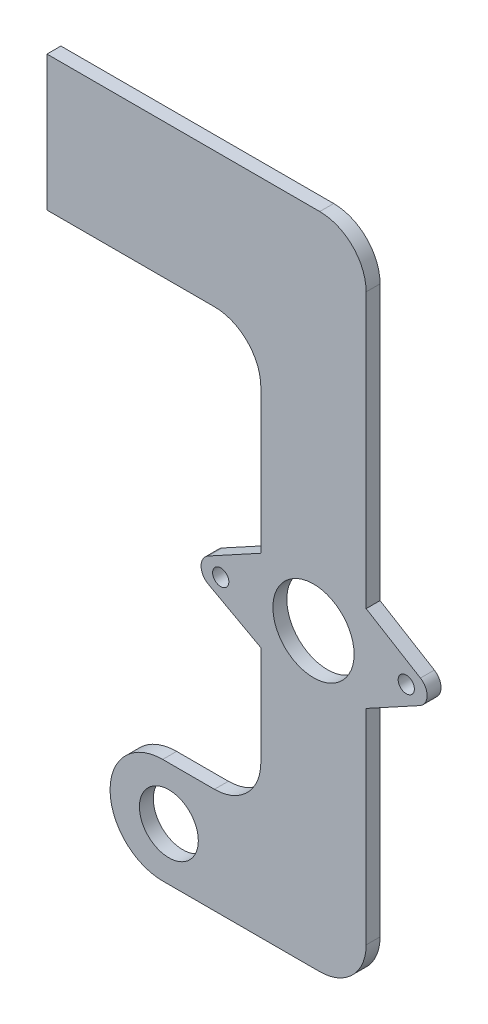
from build123d import *

# Parameters (mm, degrees)
SKETCH1_R           = 3.5
SKETCH1_R_2         = 17.5
SKETCH1_R_3         = 12.7
BOSS_EXTRUDE1_DEPTH = 6


with BuildPart() as part:
    # Sketch1 → Boss-Extrude1 (new body)
    with BuildSketch(Plane.XY):
        with BuildLine():
            Line((-45.343148698, -5.267373437), (-22.7, -17.618181818))
            Line((-22.7, -17.618181818), (-22.7, -60.51))
            ThreePointArc((-22.7, -60.51), (-28.557864376, -74.652135624), (-42.7, -80.51))
            Line((-42.7, -80.51), (-65.01, -80.51))
            ThreePointArc((-65.01, -80.51), (-81.054252865, -87.155747135), (-87.7, -103.2))
            Line((-87.7, -103.2), (-87.7, -103.22))
            ThreePointArc((-87.7, -103.22), (-81.054252865, -119.264252865), (-65.01, -125.91))
            Line((-65.01, -125.91), (2.7, -125.91))
            ThreePointArc((2.7, -125.91), (16.842135624, -120.052135624), (22.7, -105.91))
            Line((22.7, -105.91), (22.7, -17.618181818))
            Line((22.7, -17.618181818), (45.859431933, -4.9857644))
            ThreePointArc((45.859431933, -4.9857644), (48.072395186, -2.901444613), (48.979706868, 0))
            ThreePointArc((48.979706868, 0), (48.283666187, 3.099074984), (46.103082495, 5.408575611))
            Line((46.103082495, 5.408575611), (22.7, 19.635676304))
            Line((22.7, 19.635676304), (22.7, 137.896290538))
            ThreePointArc((22.7, 137.896290538), (16.842135624, 152.038426161), (2.7, 157.896290538))
            Line((2.7, 157.896290538), (-114.900063459, 157.896290538))
            Line((-114.900063459, 157.896290538), (-114.900063459, 99.635676304))
            Line((-114.900063459, 99.635676304), (-42.7, 99.635676304))
            ThreePointArc((-42.7, 99.635676304), (-28.557864376, 93.777811928), (-22.7, 79.635676304))
            Line((-22.7, 79.635676304), (-22.7, 17.618181818))
            Line((-22.7, 17.618181818), (-45.343148698, 5.267373437))
            ThreePointArc((-45.343148698, 5.267373437), (-48.470035914, 0), (-45.343148698, -5.267373437))
        make_face()
        with Locations((-40, 0)):
            Circle(SKETCH1_R, mode=Mode.SUBTRACT)
        Circle(SKETCH1_R_2, mode=Mode.SUBTRACT)
        with Locations((40, 0)):
            Circle(SKETCH1_R, mode=Mode.SUBTRACT)
        with Locations((-62.35, -103.21)):
            Circle(SKETCH1_R_3, mode=Mode.SUBTRACT)
    extrude(amount=BOSS_EXTRUDE1_DEPTH)


solid = part.part
